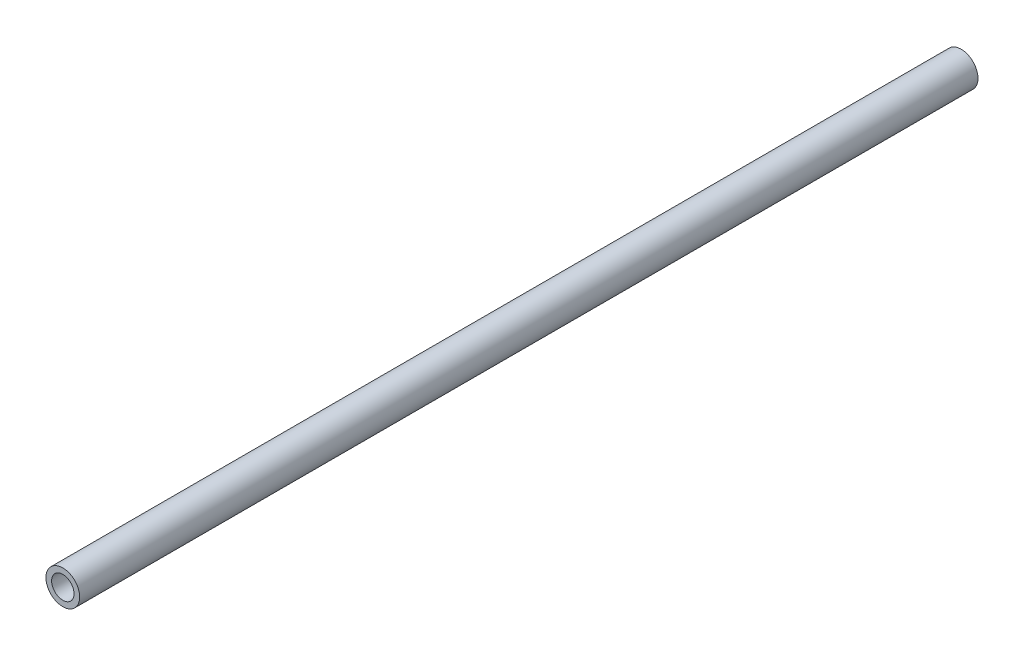
from build123d import *

# Parameters (mm, degrees)
SKETCH2_R           = 7.5
SKETCH2_R_2         = 5
BOSS_EXTRUDE1_DEPTH = 400


with BuildPart() as part:
    # Sketch2 → Boss-Extrude1 (new body)
    with BuildSketch(Plane.XY):
        Circle(SKETCH2_R)
        Circle(SKETCH2_R_2, mode=Mode.SUBTRACT)
    extrude(amount=BOSS_EXTRUDE1_DEPTH)


solid = part.part
